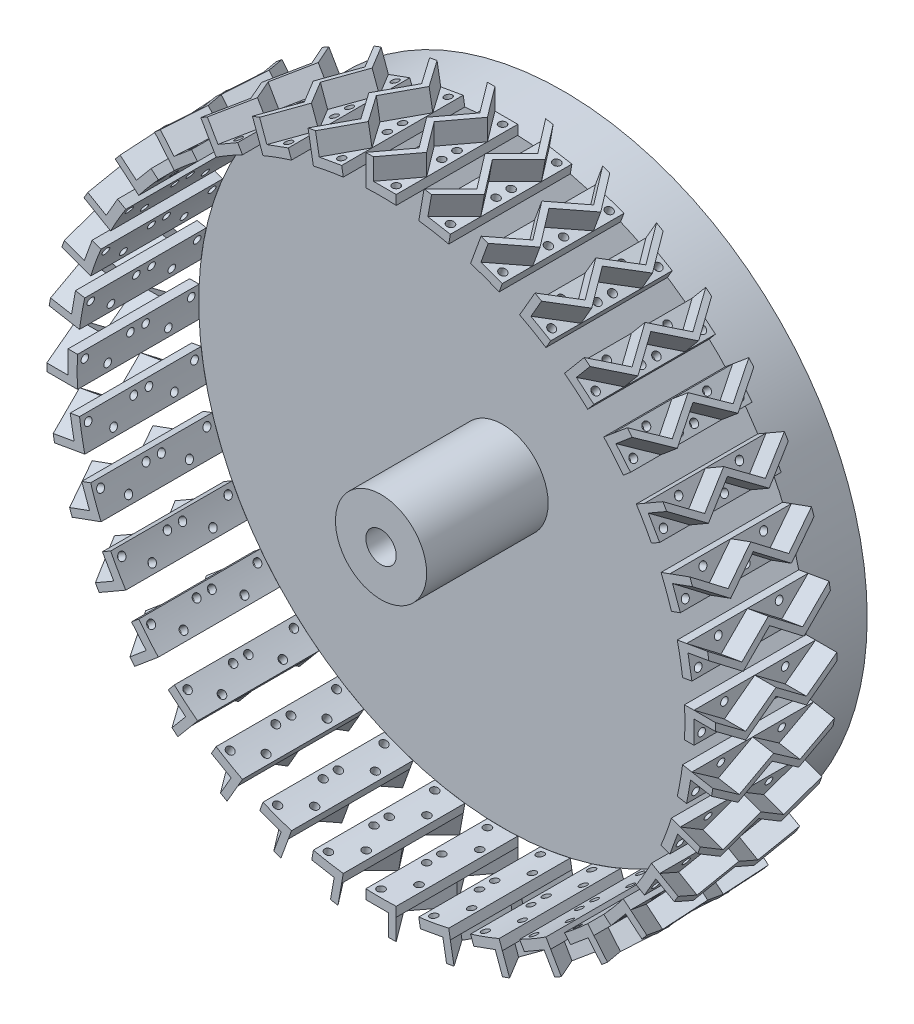
from build123d import *

# Parameters (mm, degrees)
SKETCH1_R           = 127
BOSS_EXTRUDE1_DEPTH = 50.8
SKETCH2_W           = 25.4
SKETCH2_H           = 12.7
SKETCH2_R           = 1.5875
BOSS_EXTRUDE2_DEPTH = 15.24
SKETCH2_4_R         = 1.5875
CUT_EXTRUDE1_DEPTH  = 8.89
LPATTERN1_COUNT     = 2
LPATTERN1_PITCH     = 25.4
SKETCH1_2_R         = 127
CUT_EXTRUDE2_DEPTH  = 101.6
SKETCH1_3_R         = 127
BOSS_EXTRUDE3_DEPTH = 25.4
CIRPATTERN1_COUNT   = 36
SKETCH4_R           = 19.05
SKETCH4_R_2         = 6.35
BOSS_EXTRUDE4_DEPTH = 50.8


with BuildPart() as part:
    # Sketch1 → Boss-Extrude1 (new body)
    with BuildSketch(Plane.XY):
        Circle(SKETCH1_R)
    extrude(amount=BOSS_EXTRUDE1_DEPTH)


with BuildPart() as body_2:
    # Sketch2 → Boss-Extrude2 (new body)
    with BuildSketch(Plane(origin=(139.7, 0, 0), x_dir=(0, 0, -1), z_dir=(1, 0, 0))):
        with Locations((-12.7, 0)):
            Rectangle(SKETCH2_W, SKETCH2_H)
        with Locations((-3.175, -3.175)):
            Circle(SKETCH2_R, mode=Mode.SUBTRACT)
        with Locations((-22.225, -3.175)):
            Circle(SKETCH2_R, mode=Mode.SUBTRACT)
        with Locations((-12.7, 3.175)):
            Circle(SKETCH2_R, mode=Mode.SUBTRACT)
    extrude(amount=-BOSS_EXTRUDE2_DEPTH)

    # Sketch2<4> → Cut-Extrude1 (cut)
    # profile 1 of 3: a face of its own
    with BuildSketch(Plane(origin=(139.7, 0, 0), x_dir=(0, 0, -1), z_dir=(1, 0, 0))):
        Polygon((0, -6.35), (0, 3.175), (-12.7, -6.35), align=None)
        with Locations((-3.175, -3.175)):
            Circle(SKETCH2_4_R, mode=Mode.SUBTRACT)
    # profile 2 of 3: a face of its own
    with BuildSketch(Plane(origin=(139.7, 0, 0), x_dir=(0, 0, -1), z_dir=(1, 0, 0))):
        Polygon((-12.7, -3.175), (0, 6.35), (-25.4, 6.35), align=None)
        with Locations((-12.7, 3.175)):
            Circle(SKETCH2_4_R, mode=Mode.SUBTRACT)
    # profile 3 of 3: a face of its own
    with BuildSketch(Plane(origin=(139.7, 0, 0), x_dir=(0, 0, -1), z_dir=(1, 0, 0))):
        Polygon((-25.4, -6.35), (-12.7, -6.35), (-25.4, 3.175), align=None)
        with Locations((-22.225, -3.175)):
            Circle(SKETCH2_4_R, mode=Mode.SUBTRACT)
    extrude(amount=-CUT_EXTRUDE1_DEPTH, mode=Mode.SUBTRACT)


with BuildPart() as lpattern1_1:
    # LPattern1: pattern copy
    add(body_2.part.moved(Location(Vector(0, 0, 1) * (1 * LPATTERN1_PITCH))))

    # Combine1: union body 2
    add(body_2.part)


with BuildPart() as cut_extrude2_tool:
    # Sketch1<2> → Cut-Extrude2 (new body)
    with BuildSketch(Plane.XY):
        Circle(SKETCH1_2_R)
    extrude(amount=CUT_EXTRUDE2_DEPTH)


with BuildPart() as part_1:
    add(part.part)

    # Cut-Extrude2: cut by cut_extrude2_tool
    add(cut_extrude2_tool.part, mode=Mode.SUBTRACT)


with BuildPart() as lpattern1_1_1:
    add(lpattern1_1.part)

    # Cut-Extrude2: cut by cut_extrude2_tool
    add(cut_extrude2_tool.part, mode=Mode.SUBTRACT)


with BuildPart() as body_2_2:
    # Sketch1<3> → Boss-Extrude3 (new body)
    with BuildSketch(Plane.XY):
        Circle(SKETCH1_3_R)
    extrude(amount=-BOSS_EXTRUDE3_DEPTH)


with BuildPart() as cirpattern1_1:
    # CirPattern1: pattern copy
    add(lpattern1_1_1.part.rotate(Axis((0, 0, 0), (0, 0, 1)), 1 * 360 / CIRPATTERN1_COUNT))


with BuildPart() as cirpattern1_2:
    # CirPattern1: pattern copy
    add(lpattern1_1_1.part.rotate(Axis((0, 0, 0), (0, 0, 1)), 2 * 360 / CIRPATTERN1_COUNT))


with BuildPart() as cirpattern1_3:
    # CirPattern1: pattern copy
    add(lpattern1_1_1.part.rotate(Axis((0, 0, 0), (0, 0, 1)), 3 * 360 / CIRPATTERN1_COUNT))


with BuildPart() as cirpattern1_4:
    # CirPattern1: pattern copy
    add(lpattern1_1_1.part.rotate(Axis((0, 0, 0), (0, 0, 1)), 4 * 360 / CIRPATTERN1_COUNT))


with BuildPart() as cirpattern1_5:
    # CirPattern1: pattern copy
    add(lpattern1_1_1.part.rotate(Axis((0, 0, 0), (0, 0, 1)), 5 * 360 / CIRPATTERN1_COUNT))


with BuildPart() as cirpattern1_6:
    # CirPattern1: pattern copy
    add(lpattern1_1_1.part.rotate(Axis((0, 0, 0), (0, 0, 1)), 6 * 360 / CIRPATTERN1_COUNT))


with BuildPart() as cirpattern1_7:
    # CirPattern1: pattern copy
    add(lpattern1_1_1.part.rotate(Axis((0, 0, 0), (0, 0, 1)), 7 * 360 / CIRPATTERN1_COUNT))


with BuildPart() as cirpattern1_8:
    # CirPattern1: pattern copy
    add(lpattern1_1_1.part.rotate(Axis((0, 0, 0), (0, 0, 1)), 8 * 360 / CIRPATTERN1_COUNT))


with BuildPart() as cirpattern1_9:
    # CirPattern1: pattern copy
    add(lpattern1_1_1.part.rotate(Axis((0, 0, 0), (0, 0, 1)), 9 * 360 / CIRPATTERN1_COUNT))


with BuildPart() as cirpattern1_10:
    # CirPattern1: pattern copy
    add(lpattern1_1_1.part.rotate(Axis((0, 0, 0), (0, 0, 1)), 10 * 360 / CIRPATTERN1_COUNT))


with BuildPart() as cirpattern1_11:
    # CirPattern1: pattern copy
    add(lpattern1_1_1.part.rotate(Axis((0, 0, 0), (0, 0, 1)), 11 * 360 / CIRPATTERN1_COUNT))


with BuildPart() as cirpattern1_12:
    # CirPattern1: pattern copy
    add(lpattern1_1_1.part.rotate(Axis((0, 0, 0), (0, 0, 1)), 12 * 360 / CIRPATTERN1_COUNT))


with BuildPart() as cirpattern1_13:
    # CirPattern1: pattern copy
    add(lpattern1_1_1.part.rotate(Axis((0, 0, 0), (0, 0, 1)), 13 * 360 / CIRPATTERN1_COUNT))


with BuildPart() as cirpattern1_14:
    # CirPattern1: pattern copy
    add(lpattern1_1_1.part.rotate(Axis((0, 0, 0), (0, 0, 1)), 14 * 360 / CIRPATTERN1_COUNT))


with BuildPart() as cirpattern1_15:
    # CirPattern1: pattern copy
    add(lpattern1_1_1.part.rotate(Axis((0, 0, 0), (0, 0, 1)), 15 * 360 / CIRPATTERN1_COUNT))


with BuildPart() as cirpattern1_16:
    # CirPattern1: pattern copy
    add(lpattern1_1_1.part.rotate(Axis((0, 0, 0), (0, 0, 1)), 16 * 360 / CIRPATTERN1_COUNT))


with BuildPart() as cirpattern1_17:
    # CirPattern1: pattern copy
    add(lpattern1_1_1.part.rotate(Axis((0, 0, 0), (0, 0, 1)), 17 * 360 / CIRPATTERN1_COUNT))


with BuildPart() as cirpattern1_18:
    # CirPattern1: pattern copy
    add(lpattern1_1_1.part.rotate(Axis((0, 0, 0), (0, 0, 1)), 18 * 360 / CIRPATTERN1_COUNT))


with BuildPart() as cirpattern1_19:
    # CirPattern1: pattern copy
    add(lpattern1_1_1.part.rotate(Axis((0, 0, 0), (0, 0, 1)), 19 * 360 / CIRPATTERN1_COUNT))


with BuildPart() as cirpattern1_20:
    # CirPattern1: pattern copy
    add(lpattern1_1_1.part.rotate(Axis((0, 0, 0), (0, 0, 1)), 20 * 360 / CIRPATTERN1_COUNT))


with BuildPart() as cirpattern1_21:
    # CirPattern1: pattern copy
    add(lpattern1_1_1.part.rotate(Axis((0, 0, 0), (0, 0, 1)), 21 * 360 / CIRPATTERN1_COUNT))


with BuildPart() as cirpattern1_22:
    # CirPattern1: pattern copy
    add(lpattern1_1_1.part.rotate(Axis((0, 0, 0), (0, 0, 1)), 22 * 360 / CIRPATTERN1_COUNT))


with BuildPart() as cirpattern1_23:
    # CirPattern1: pattern copy
    add(lpattern1_1_1.part.rotate(Axis((0, 0, 0), (0, 0, 1)), 23 * 360 / CIRPATTERN1_COUNT))


with BuildPart() as cirpattern1_24:
    # CirPattern1: pattern copy
    add(lpattern1_1_1.part.rotate(Axis((0, 0, 0), (0, 0, 1)), 24 * 360 / CIRPATTERN1_COUNT))


with BuildPart() as cirpattern1_25:
    # CirPattern1: pattern copy
    add(lpattern1_1_1.part.rotate(Axis((0, 0, 0), (0, 0, 1)), 25 * 360 / CIRPATTERN1_COUNT))


with BuildPart() as cirpattern1_26:
    # CirPattern1: pattern copy
    add(lpattern1_1_1.part.rotate(Axis((0, 0, 0), (0, 0, 1)), 26 * 360 / CIRPATTERN1_COUNT))


with BuildPart() as cirpattern1_27:
    # CirPattern1: pattern copy
    add(lpattern1_1_1.part.rotate(Axis((0, 0, 0), (0, 0, 1)), 27 * 360 / CIRPATTERN1_COUNT))


with BuildPart() as cirpattern1_28:
    # CirPattern1: pattern copy
    add(lpattern1_1_1.part.rotate(Axis((0, 0, 0), (0, 0, 1)), 28 * 360 / CIRPATTERN1_COUNT))


with BuildPart() as cirpattern1_29:
    # CirPattern1: pattern copy
    add(lpattern1_1_1.part.rotate(Axis((0, 0, 0), (0, 0, 1)), 29 * 360 / CIRPATTERN1_COUNT))


with BuildPart() as cirpattern1_30:
    # CirPattern1: pattern copy
    add(lpattern1_1_1.part.rotate(Axis((0, 0, 0), (0, 0, 1)), 30 * 360 / CIRPATTERN1_COUNT))


with BuildPart() as cirpattern1_31:
    # CirPattern1: pattern copy
    add(lpattern1_1_1.part.rotate(Axis((0, 0, 0), (0, 0, 1)), 31 * 360 / CIRPATTERN1_COUNT))


with BuildPart() as cirpattern1_32:
    # CirPattern1: pattern copy
    add(lpattern1_1_1.part.rotate(Axis((0, 0, 0), (0, 0, 1)), 32 * 360 / CIRPATTERN1_COUNT))


with BuildPart() as cirpattern1_33:
    # CirPattern1: pattern copy
    add(lpattern1_1_1.part.rotate(Axis((0, 0, 0), (0, 0, 1)), 33 * 360 / CIRPATTERN1_COUNT))


with BuildPart() as cirpattern1_34:
    # CirPattern1: pattern copy
    add(lpattern1_1_1.part.rotate(Axis((0, 0, 0), (0, 0, 1)), 34 * 360 / CIRPATTERN1_COUNT))


with BuildPart() as cirpattern1_35:
    # CirPattern1: pattern copy
    add(lpattern1_1_1.part.rotate(Axis((0, 0, 0), (0, 0, 1)), 35 * 360 / CIRPATTERN1_COUNT))


with BuildPart() as body_38:
    # Sketch4 → Boss-Extrude4 (new body)
    with BuildSketch(Plane.XY.offset(50.8)):
        Circle(SKETCH4_R)
        Circle(SKETCH4_R_2, mode=Mode.SUBTRACT)
    extrude(amount=-BOSS_EXTRUDE4_DEPTH)


solid = Compound([lpattern1_1_1.part, body_2_2.part, cirpattern1_1.part, cirpattern1_2.part, cirpattern1_3.part, cirpattern1_4.part, cirpattern1_5.part, cirpattern1_6.part, cirpattern1_7.part, cirpattern1_8.part, cirpattern1_9.part, cirpattern1_10.part, cirpattern1_11.part, cirpattern1_12.part, cirpattern1_13.part, cirpattern1_14.part, cirpattern1_15.part, cirpattern1_16.part, cirpattern1_17.part, cirpattern1_18.part, cirpattern1_19.part, cirpattern1_20.part, cirpattern1_21.part, cirpattern1_22.part, cirpattern1_23.part, cirpattern1_24.part, cirpattern1_25.part, cirpattern1_26.part, cirpattern1_27.part, cirpattern1_28.part, cirpattern1_29.part, cirpattern1_30.part, cirpattern1_31.part, cirpattern1_32.part, cirpattern1_33.part, cirpattern1_34.part, cirpattern1_35.part, body_38.part])
